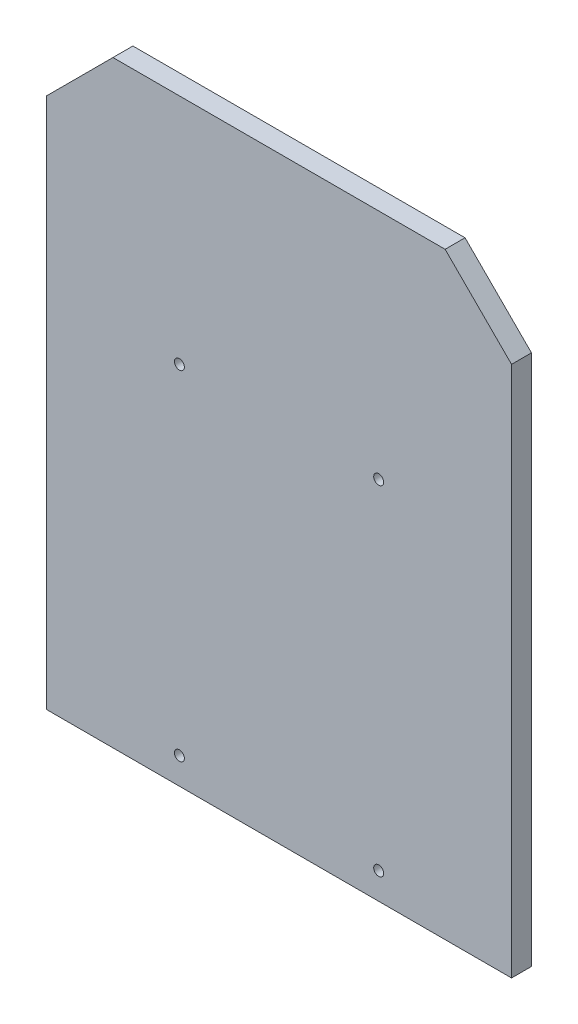
from build123d import *

# Parameters (mm, degrees)
CROQUIS1_W              = 70
CROQUIS1_H              = 90
SALIENTE_EXTRUIR1_DEPTH = 3
CROQUIS2_R              = 1
CORTAR_EXTRUIR1_DEPTH   = 3
CHAFL_N1_SIZE           = 10
CHAFL_N2_SIZE           = 10
CROQUIS4_W              = 66.199172227
CROQUIS4_H              = 50.611167931
SALIENTE_EXTRUIR2_DEPTH = 3
CROQUIS5_R              = 0.75
CORTAR_EXTRUIR2_DEPTH   = 67.497809415


with BuildPart() as part:
    # Croquis1 → Saliente-Extruir1 (new body)
    with BuildSketch(Plane.XY):
        with Locations((4.954489614, -8.071625344)):
            Rectangle(CROQUIS1_W, CROQUIS1_H)
    extrude(amount=SALIENTE_EXTRUIR1_DEPTH)

    # Croquis2 → Cortar-Extruir1 (cut)
    with BuildSketch(Plane(origin=(0, 0, 0), x_dir=(-1, 0, 0), z_dir=(0, 0, -1))):
        with Locations((-34.954489614, -49.571625344)):
            Circle(CROQUIS2_R)
        with Locations((25.045510386, -49.571625344)):
            Circle(CROQUIS2_R)
        with Locations((-34.954489614, -6.571625344)):
            Circle(CROQUIS2_R)
        with Locations((25.045510386, -6.571625344)):
            Circle(CROQUIS2_R)
    extrude(amount=-CORTAR_EXTRUIR1_DEPTH, mode=Mode.SUBTRACT)

    # Chaflán1
    chafl_n1_edges = [part.edges().sort_by_distance(p)[0] for p in [
        (39.954489614, 36.928374656, 1.5),
    ]]
    chamfer(chafl_n1_edges, length=CHAFL_N1_SIZE)

    # Chaflán2
    chafl_n2_edges = [part.edges().sort_by_distance(p)[0] for p in [
        (-30.045510386, 36.928374656, 1.5),
    ]]
    chamfer(chafl_n2_edges, length=CHAFL_N2_SIZE)

    # Croquis4 → Saliente-Extruir2 (add)
    with BuildSketch(Plane.XY.offset(3)):
        with Locations((4.57620863, -27.766041379)):
            Rectangle(CROQUIS4_W, CROQUIS4_H)
    extrude(amount=-SALIENTE_EXTRUIR2_DEPTH)

    # Croquis5 → Cortar-Extruir2 (cut, through all)
    with BuildSketch(Plane.XY.offset(3)):
        with Locations((-10.045510386, 1.928374656)):
            Circle(CROQUIS5_R)
        with Locations((19.954489614, 1.928374656)):
            Circle(CROQUIS5_R)
        with Locations((-10.045510386, -49.071625344)):
            Circle(CROQUIS5_R)
        with Locations((19.954489614, -49.071625344)):
            Circle(CROQUIS5_R)
    extrude(amount=-CORTAR_EXTRUIR2_DEPTH, mode=Mode.SUBTRACT)


solid = part.part
